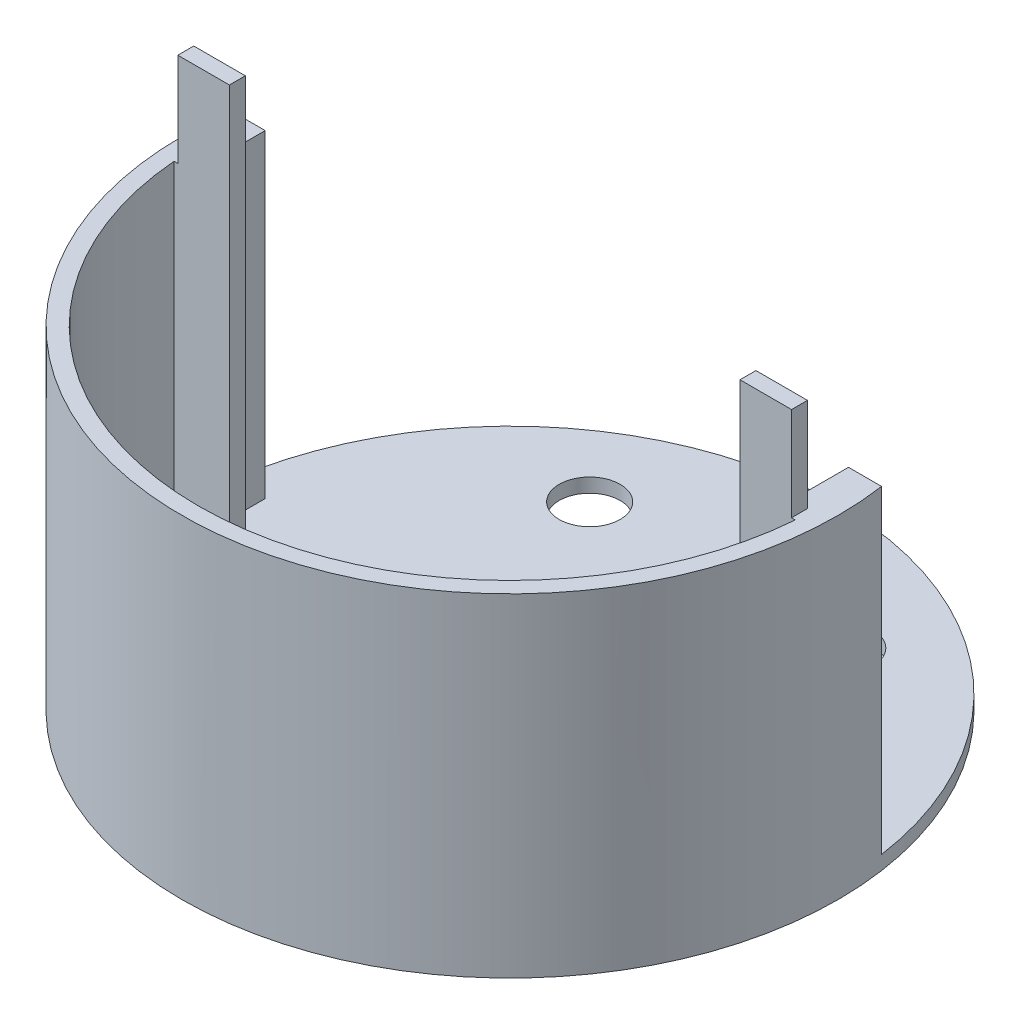
from build123d import *

# Parameters (mm, degrees)
SKETCH1_R           = 35
SKETCH1_R_2         = 2.75
SKETCH1_R_3         = 3.25
BOSS_EXTRUDE1_DEPTH = 1.5
BOSS_EXTRUDE2_DEPTH = 34
SKETCH3_W           = 5.5
SKETCH3_H           = 1.7
BOSS_EXTRUDE3_DEPTH = 10
BOSS_EXTRUDE4_DEPTH = 34


with BuildPart() as part:
    # Sketch1 → Boss-Extrude1 (new body)
    with BuildSketch(Plane(origin=(0, 0, 0), x_dir=(1, 0, 0), z_dir=(0, 1, 0))):
        Circle(SKETCH1_R)
        with Locations((-27, -7.4)):
            Circle(SKETCH1_R_2, mode=Mode.SUBTRACT)
        with Locations((27, -7.4)):
            Circle(SKETCH1_R_2, mode=Mode.SUBTRACT)
        with Locations((-13.5, 22)):
            Circle(SKETCH1_R_3, mode=Mode.SUBTRACT)
        with Locations((13.5, 22)):
            Circle(SKETCH1_R_3, mode=Mode.SUBTRACT)
    extrude(amount=BOSS_EXTRUDE1_DEPTH)

    # Sketch2 → Boss-Extrude2 (add)
    with BuildSketch(Plane(origin=(0, 1.5, 0), x_dir=(1, 0, 0), z_dir=(0, 1, 0))):
        with BuildLine():
            Line((-33.234959004, -1), (-34.985711369, -1))
            ThreePointArc((-34.985711369, -1), (0, -35), (34.985711369, -1))
            Line((34.985711369, -1), (33.234959004, -1))
            Line((33.234959004, -1), (27.234959004, -1))
            Line((27.234959004, -1), (27.234959004, -2.7))
            Line((27.234959004, -2.7), (33.140194628, -2.7))
            ThreePointArc((33.140194628, -2.7), (0, -33.25), (-33.140194628, -2.7))
            Line((-33.140194628, -2.7), (-27.234959004, -2.7))
            Line((-27.234959004, -2.7), (-27.234959004, -1))
            Line((-27.234959004, -1), (-33.234959004, -1))
        make_face()
    extrude(amount=BOSS_EXTRUDE2_DEPTH)

    # Sketch3 → Boss-Extrude3 (add)
    with BuildSketch(Plane(origin=(0, 35.5, 0), x_dir=(1, 0, 0), z_dir=(0, 1, 0))):
        with Locations((-29.984959004, -1.85)):
            Rectangle(SKETCH3_W, SKETCH3_H)
        with Locations((29.984959004, -1.85)):
            Rectangle(SKETCH3_W, SKETCH3_H)
    extrude(amount=BOSS_EXTRUDE3_DEPTH)

    # Sketch4 → Boss-Extrude4 (add)
    with BuildSketch(Plane(origin=(0, 1.5, 0), x_dir=(1, 0, 0), z_dir=(0, 1, 0))):
        with BuildLine():
            Line((-34.985711369, -1), (-31.110335187, -1))
            Line((-31.110335187, -1), (-31.110335187, 5))
            Line((-31.110335187, 5), (-34.641016151, 5))
            ThreePointArc((-34.641016151, 5), (-34.942385384, 2.007412189), (-34.985711369, -1))
        make_face()
        with BuildLine():
            Line((34.985711369, -1), (31.110335187, -1))
            Line((31.110335187, -1), (31.110335187, 5))
            Line((31.110335187, 5), (34.641016151, 5))
            ThreePointArc((34.641016151, 5), (34.942385384, 2.007412189), (34.985711369, -1))
        make_face()
    extrude(amount=BOSS_EXTRUDE4_DEPTH)


solid = part.part
